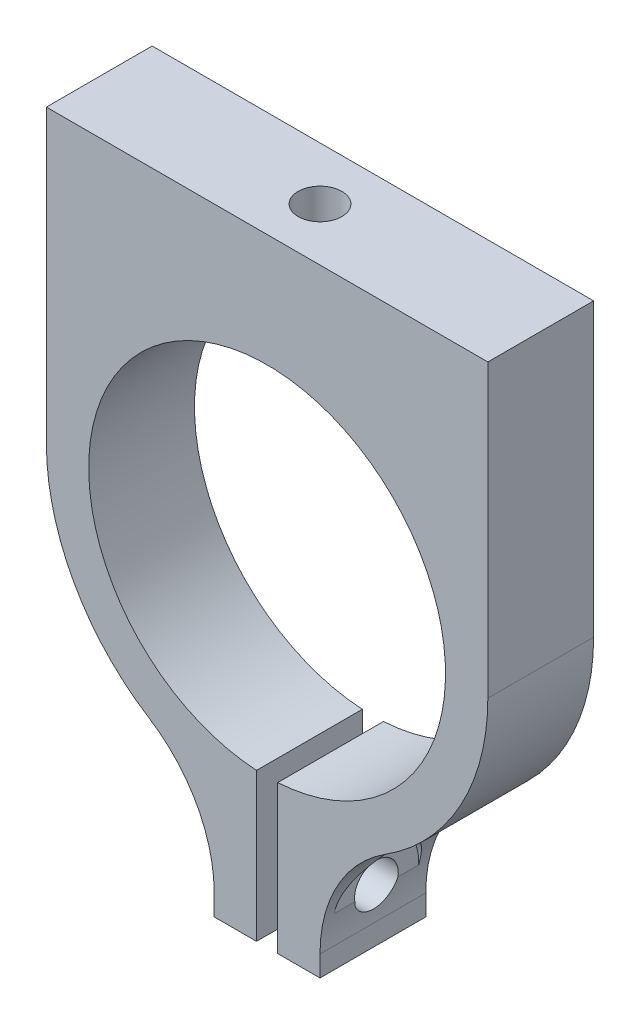
from build123d import *
from build123d.topology import SkipClean

# Parameters (mm, degrees)
BOSS_EXTRUDE1_DEPTH   = 20
SKETCH2_W             = 3
SKETCH2_H             = 10.5
BOSS_EXTRUDE2_DEPTH   = 20
SKETCH4_W             = 31.3
SKETCH4_H             = 40
BOSS_EXTRUDE3_DEPTH   = 5
SKETCH5_W             = 25
SKETCH5_H             = 37.777747226
CUT_EXTRUDE2_DEPTH    = 13.65
SKETCH6_R             = 1.55
MOTORMOUNTHOLES_DEPTH = 6
CLAMPHOLES_REACH      = 38.211
SKETCH8_R             = 1.55
ENDSTOPPER_DEPTH      = 2
CUT_EXTRUDE7_START    = -15.65
SKETCH10_W            = 25
SKETCH10_H            = 37.777747226
CUT_EXTRUDE7_DEPTH    = 13.65
SKETCH11_W            = 25
SKETCH11_H            = 10.636850541
CUT_EXTRUDE8_DEPTH    = 4
FILLET1_START         = -20
FILLET1_DEPTH         = 2.1999999
FILLET1_START_2       = -14.6999999
FILLET1_2_DEPTH       = 2.1999999
FILLET1_START_3       = 12.5
FILLET1_3_DEPTH       = 2.1999999
FILLET1_START_4       = 17.8000001
FILLET1_4_DEPTH       = 2.1999999
FILLET1_START_5       = -17.8000001
FILLET1_5_DEPTH       = 3.1000002
FILLET1_START_6       = 14.6999999
FILLET1_6_DEPTH       = 3.1000002
FILLET1_START_7       = -8.389376218
FILLET1_7_OUTLINE_R   = 1.55
FILLET1_7_DEPTH       = 16.778752436
SKETCH13_W            = 10
SKETCH13_H            = 10
CUT_EXTRUDE10_REACH   = 40.348
CUT_EXTRUDE10_START   = 4
SKETCH15_R            = 3
CUT_EXTRUDE11_START   = -4
CUT_EXTRUDE11_DEPTH   = 3
SKETCH17_R            = 6
SHAFT_CLEARANCE_DEPTH = 0.4
SKETCH18_W            = 60.470736223
SKETCH18_H            = 67.356637863
CUT_EXTRUDE12_DEPTH   = 25
SKETCH19_R            = 1.55
CUT_EXTRUDE13_DEPTH   = 7
CUT_EXTRUDE14_START   = -3
CUT_EXTRUDE14_DEPTH   = 2.6


with BuildPart() as part:
    # Sketch1 → Boss-Extrude1 (new, symmetric)
    with BuildSketch(Plane.XY):
        with BuildLine():
            Line((-15.65, 15.65), (-15.65, 0))
            ThreePointArc((-15.65, 0), (-11.066221106, 11.066221145), (5.4e-08, 15.65))
            Line((5.4e-08, 15.65), (-15.65, 15.65))
        make_face()
        with BuildLine():
            Line((15.65, 15.65), (5.4e-08, 15.65))
            ThreePointArc((5.4e-08, 15.65), (11.066221145, 11.066221106), (15.65, 0))
            Line((15.65, 0), (15.65, 15.65))
        make_face()
        with BuildLine():
            ThreePointArc((5.4e-08, 15.65), (-11.066221106, 11.066221145), (-15.65, 0))
            ThreePointArc((-15.65, 0), (-11.328283189, -10.797800702), (-0.75, -15.632018424))
            Line((-0.75, -15.632018424), (-0.75, -12.627747226))
            ThreePointArc((-0.75, -12.627747226), (-8.675684411, 9.206247878), (12.65, 0))
            ThreePointArc((12.65, 0), (9.206247878, -8.675684411), (0.75, -12.627747226))
            Line((0.75, -12.627747226), (0.75, -15.632018424))
            ThreePointArc((0.75, -15.632018424), (11.328283189, -10.797800702), (15.65, 0))
            ThreePointArc((15.65, 0), (11.066221145, 11.066221106), (5.4e-08, 15.65))
        make_face()
    extrude(amount=BOSS_EXTRUDE1_DEPTH, both=True)

    # Sketch2 → Boss-Extrude2 (add, symmetric)
    with BuildSketch(Plane.XY):
        with Locations((-2.25, -17.877747226)):
            Rectangle(SKETCH2_W, SKETCH2_H)
        with Locations((2.25, -17.877747226)):
            Rectangle(SKETCH2_W, SKETCH2_H)
    extrude(amount=BOSS_EXTRUDE2_DEPTH, both=True)

    # Sketch4 → Boss-Extrude3 (add)
    with BuildSketch(Plane(origin=(0, 15.65, 0), x_dir=(1, 0, 0), z_dir=(0, 1, 0))):
        Rectangle(SKETCH4_W, SKETCH4_H)
    extrude(amount=BOSS_EXTRUDE3_DEPTH)

    # Sketch5 → Cut-Extrude2 (cut)
    with BuildSketch(Plane(origin=(15.65, 0, 0), x_dir=(0, 0, -1), z_dir=(1, 0, 0))):
        with Locations((0, -4.238873613)):
            Rectangle(SKETCH5_W, SKETCH5_H)
    extrude(amount=-CUT_EXTRUDE2_DEPTH, mode=Mode.SUBTRACT)

    # Sketch6 → MotorMountHoles (cut)
    with BuildSketch(Plane(origin=(0, 20.65, 0), x_dir=(1, 0, 0), z_dir=(0, 1, 0))):
        with Locations(Location((-8.838834765, 8.838834765, 0), (0, 0, 270))):
            Circle(SKETCH6_R)
        with Locations(Location((8.838834765, 8.838834765, 0), (0, 0, 270))):
            Circle(SKETCH6_R)
        with Locations(Location((8.838834765, -8.838834765, 0), (0, 0, 270))):
            Circle(SKETCH6_R)
        with Locations(Location((-8.838834765, -8.838834765, 0), (0, 0, 270))):
            Circle(SKETCH6_R)
    extrude(amount=-MOTORMOUNTHOLES_DEPTH, mode=Mode.SUBTRACT)

    # ClampHoles: up to this face of the body (flat: up to its plane)
    clampholes_end = Plane(part.part.faces().sort_by_distance((3.75, -19.16091251, 16.25))[0])
    # Sketch8 → ClampHoles (cut, up to the picked face)
    with BuildSketch(Plane.ZY.offset(3.75), mode=Mode.PRIVATE) as clampholes_sk1:
        with Locations(Location((16.25, -19.194077794, 0), (0, 0, 270))):
            Circle(SKETCH8_R)
    clampholes_tool1 = split(extrude(clampholes_sk1.sketch, amount=-CLAMPHOLES_REACH, mode=Mode.PRIVATE), bisect_by=clampholes_end, keep=Keep.BOTH, mode=Mode.PRIVATE)
    # Sketch8 → ClampHoles (cut, up to the picked face)
    with BuildSketch(Plane.ZY.offset(3.75), mode=Mode.PRIVATE) as clampholes_sk2:
        with Locations(Location((-16.25, -19.194077794, 0), (0, 0, 270))):
            Circle(SKETCH8_R)
    clampholes_tool2 = split(extrude(clampholes_sk2.sketch, amount=-CLAMPHOLES_REACH, mode=Mode.PRIVATE), bisect_by=clampholes_end, keep=Keep.BOTH, mode=Mode.PRIVATE)
    add(clampholes_tool1.solids().sort_by(Axis((-3.75, -19.194078, 16.25), (1, 0, 0)))[0], mode=Mode.SUBTRACT)
    add(clampholes_tool2.solids().sort_by(Axis((-3.75, -19.194078, -16.25), (1, 0, 0)))[0], mode=Mode.SUBTRACT)

    # Sketch9 → EndStopper (add)
    with BuildSketch(Plane.XY.offset(20)):
        with BuildLine():
            ThreePointArc((12.65, 0), (-8.675684411, 9.206247878), (-0.75, -12.627747226))
            Line((-0.75, -12.627747226), (-0.75, -7.964766161))
            ThreePointArc((-0.75, -7.964766161), (-5.385164807, 5.916079783), (8, 0))
            ThreePointArc((8, 0), (5.916079783, -5.385164807), (0.75, -7.964766161))
            Line((0.75, -7.964766161), (0.75, -12.627747226))
            ThreePointArc((0.75, -12.627747226), (9.206247878, -8.675684411), (12.65, 0))
        make_face()
    extrude(amount=-ENDSTOPPER_DEPTH)

    # Sketch10 → Cut-Extrude7 (cut)
    with BuildSketch(Plane(origin=(0, 0, 0), x_dir=(0, 0, -1), z_dir=(1, 0, 0)).offset(CUT_EXTRUDE7_START)):
        with Locations((0, -4.238873613)):
            Rectangle(SKETCH10_W, SKETCH10_H)
    extrude(amount=CUT_EXTRUDE7_DEPTH, mode=Mode.SUBTRACT)

    # Sketch11 → Cut-Extrude8 (cut)
    with BuildSketch(Plane.ZY.offset(2)):
        with Locations((0, -17.809321955)):
            Rectangle(SKETCH11_W, SKETCH11_H)
    extrude(amount=-CUT_EXTRUDE8_DEPTH, mode=Mode.SUBTRACT)

    # Fillet1: read off the stored shape, not the designer's step
    # Fillet1 outline → Fillet1 (add)
    with BuildSketch(Plane.XY.offset(FILLET1_START)):
        with BuildLine():
            Line((3.75, -15.194077794), (3.75, -21.653175287))
            ThreePointArc((3.75, -21.653175287), (4.986261134, -16.83686123), (8.389376218, -13.211391549))
            ThreePointArc((8.389376218, -13.211391549), (6.150111782, -14.39092162), (3.75, -15.194077794))
        make_face()
        with BuildLine():
            ThreePointArc((-3.75, -15.194077794), (-6.150111782, -14.39092162), (-8.389376218, -13.21139155))
            ThreePointArc((-8.389376218, -13.21139155), (-4.986261134, -16.83686123), (-3.75, -21.653175287))
            Line((-3.75, -21.653175287), (-3.75, -15.194077794))
        make_face()
    extrude(amount=FILLET1_DEPTH)

    # Fillet1 2 outline → Fillet1 2 (add)
    with BuildSketch(Plane.XY.offset(FILLET1_START_2)):
        with BuildLine():
            Line((3.75, -15.194077794), (3.75, -21.653175287))
            ThreePointArc((3.75, -21.653175287), (4.986261134, -16.83686123), (8.389376218, -13.211391549))
            ThreePointArc((8.389376218, -13.211391549), (6.150111782, -14.39092162), (3.75, -15.194077794))
        make_face()
        with BuildLine():
            ThreePointArc((-3.75, -15.194077794), (-6.150111782, -14.39092162), (-8.389376218, -13.21139155))
            ThreePointArc((-8.389376218, -13.21139155), (-4.986261134, -16.83686123), (-3.75, -21.653175287))
            Line((-3.75, -21.653175287), (-3.75, -15.194077794))
        make_face()
    extrude(amount=FILLET1_2_DEPTH)

    # Fillet1 3 outline → Fillet1 3 (add)
    with BuildSketch(Plane.XY.offset(FILLET1_START_3)):
        with BuildLine():
            Line((3.75, -15.194077794), (3.75, -21.653175287))
            ThreePointArc((3.75, -21.653175287), (4.986261134, -16.83686123), (8.389376218, -13.211391549))
            ThreePointArc((8.389376218, -13.211391549), (6.150111782, -14.39092162), (3.75, -15.194077794))
        make_face()
        with BuildLine():
            ThreePointArc((-3.75, -15.194077794), (-6.150111782, -14.39092162), (-8.389376218, -13.21139155))
            ThreePointArc((-8.389376218, -13.21139155), (-4.986261134, -16.83686123), (-3.75, -21.653175287))
            Line((-3.75, -21.653175287), (-3.75, -15.194077794))
        make_face()
    extrude(amount=FILLET1_3_DEPTH)

    # Fillet1 4 outline → Fillet1 4 (add)
    with BuildSketch(Plane.XY.offset(FILLET1_START_4)):
        with BuildLine():
            Line((3.75, -15.194077794), (3.75, -21.653175287))
            ThreePointArc((3.75, -21.653175287), (4.986261134, -16.83686123), (8.389376218, -13.211391549))
            ThreePointArc((8.389376218, -13.211391549), (6.150111782, -14.39092162), (3.75, -15.194077794))
        make_face()
        with BuildLine():
            ThreePointArc((-3.75, -15.194077794), (-6.150111782, -14.39092162), (-8.389376218, -13.21139155))
            ThreePointArc((-8.389376218, -13.21139155), (-4.986261134, -16.83686123), (-3.75, -21.653175287))
            Line((-3.75, -21.653175287), (-3.75, -15.194077794))
        make_face()
    extrude(amount=FILLET1_4_DEPTH)

    # Fillet1 5 outline → Fillet1 5 (add)
    with BuildSketch(Plane.XY.offset(FILLET1_START_5)):
        with BuildLine():
            Line((3.75, -15.194077794), (3.75, -21.653175287))
            ThreePointArc((3.75, -21.653175287), (4.986261134, -16.83686123), (8.389376218, -13.211391549))
            ThreePointArc((8.389376218, -13.211391549), (6.150111782, -14.39092162), (3.75, -15.194077794))
        make_face()
        with BuildLine():
            ThreePointArc((-3.75, -15.194077794), (-6.150111782, -14.39092162), (-8.389376218, -13.21139155))
            ThreePointArc((-8.389376218, -13.21139155), (-4.986261134, -16.83686123), (-3.75, -21.653175287))
            Line((-3.75, -21.653175287), (-3.75, -15.194077794))
        make_face()
    extrude(amount=FILLET1_5_DEPTH)

    # Fillet1 6 outline → Fillet1 6 (add)
    with BuildSketch(Plane.XY.offset(FILLET1_START_6)):
        with BuildLine():
            Line((3.75, -15.194077794), (3.75, -21.653175287))
            ThreePointArc((3.75, -21.653175287), (4.986261134, -16.83686123), (8.389376218, -13.211391549))
            ThreePointArc((8.389376218, -13.211391549), (6.150111782, -14.39092162), (3.75, -15.194077794))
        make_face()
        with BuildLine():
            ThreePointArc((-3.75, -15.194077794), (-6.150111782, -14.39092162), (-8.389376218, -13.21139155))
            ThreePointArc((-8.389376218, -13.21139155), (-4.986261134, -16.83686123), (-3.75, -21.653175287))
            Line((-3.75, -21.653175287), (-3.75, -15.194077794))
        make_face()
    extrude(amount=FILLET1_6_DEPTH)

    # Fillet1 7 outline → Fillet1 7 (cut)
    with BuildSketch(Plane.YZ.offset(FILLET1_START_7)):
        with Locations((-19.194077794, -16.25)):
            Circle(FILLET1_7_OUTLINE_R)
        with Locations((-19.194077794, 16.25)):
            Circle(FILLET1_7_OUTLINE_R)
    extrude(amount=FILLET1_7_DEPTH, mode=Mode.SUBTRACT)

    # Cut-Sweep1: sweep along a path in Sketch12
    with BuildLine(Plane(origin=(0, 0, 0), x_dir=(0, 0, -1), z_dir=(1, 0, 0))) as cut_sweep1_path:
        Line((-2.775739564, 34.353299637), (-30.459033802, 12.328988213))
    # Sketch13 → Cut-Sweep1 (sweep, cut)
    with BuildSketch(Plane(origin=(0, 11.963370534, -15.037269505), x_dir=(-1, 0, 0), z_dir=(0, 0.6225843191548198, -0.7825527238100508))):
        with Locations((0, 29.484397462)):
            Rectangle(SKETCH13_W, SKETCH13_H)
    sweep(path=cut_sweep1_path.line, mode=Mode.SUBTRACT)

    # Sketch15 → Cut-Extrude10 (cut, up to next)
    with BuildSketch(Plane(origin=(0, 0, 0), x_dir=(0, 0, -1), z_dir=(1, 0, 0)).offset(CUT_EXTRUDE10_START), mode=Mode.PRIVATE) as cut_extrude10_sk1:
        with Locations((16.25, -19.194077794)):
            Circle(SKETCH15_R)
    cut_extrude10_tool1 = extrude(cut_extrude10_sk1.sketch, amount=CUT_EXTRUDE10_REACH, mode=Mode.PRIVATE) & part.part
    cut_extrude10 = cut_extrude10_tool1.solids().sort_by_distance((4, -19.194078, -16.25))[0]
    add(cut_extrude10, mode=Mode.SUBTRACT)

    # Sketch16 → Cut-Extrude11 (cut)
    with BuildSketch(Plane(origin=(0, 0, 0), x_dir=(0, 0, -1), z_dir=(1, 0, 0)).offset(CUT_EXTRUDE11_START)):
        Polygon((12.959103466, -19.194077794), (14.604551733, -22.044077794), (17.895448267, -22.044077794), (19.540896534, -19.194077794), (17.895448267, -16.344077794), (14.604551733, -16.344077794), align=None)
    cut_extrude11 = extrude(amount=-CUT_EXTRUDE11_DEPTH, mode=Mode.SUBTRACT)

    # Mirror1: Cut-Extrude10, Cut-Extrude11 across plane
    add(cut_extrude10.mirror(Plane.XY), mode=Mode.SUBTRACT)
    add(cut_extrude11.mirror(Plane.XY), mode=Mode.SUBTRACT)

    # Sketch17 → Shaft Clearance (cut)
    with BuildSketch(Plane(origin=(0, 20.65, 0), x_dir=(1, 0, 0), z_dir=(0, 1, 0))):
        with Locations(Location((0, 0, 0), (0, 0, 270))):
            Circle(SKETCH17_R)
    extrude(amount=-SHAFT_CLEARANCE_DEPTH, mode=Mode.SUBTRACT)

    # Sketch18 → Cut-Extrude12 (cut, symmetric)
    with SkipClean():  # the faces are left unmerged after this step: merging them gives an invalid solid
        with BuildSketch(Plane(origin=(0, 0, 0), x_dir=(0, 0, -1), z_dir=(1, 0, 0))):
            with Locations((-17.735368112, 5.054402567)):
                Rectangle(SKETCH18_W, SKETCH18_H)
        extrude(amount=CUT_EXTRUDE12_DEPTH, both=True, mode=Mode.SUBTRACT)

    # Sketch19 → Cut-Extrude13 (cut)
    with SkipClean():  # the faces are left unmerged after this step: merging them gives an invalid solid
        with BuildSketch(Plane(origin=(0, 20.65, 0), x_dir=(1, 0, 0), z_dir=(0, 1, 0))):
            with Locations(Location((0, 16.25, 0), (0, 0, 270))):
                Circle(SKETCH19_R)
        extrude(amount=-CUT_EXTRUDE13_DEPTH, mode=Mode.SUBTRACT)

    # Sketch20 → Cut-Extrude14 (cut)
    with SkipClean():  # the faces are left unmerged after this step: merging them gives an invalid solid
        with BuildSketch(Plane(origin=(0, 20.65, 0), x_dir=(1, 0, 0), z_dir=(0, 1, 0)).offset(CUT_EXTRUDE14_START)):
            Polygon((-3.290896534, 16.25), (-1.645448267, 13.4), (1.645448267, 13.4), (3.290896534, 16.25), (3.290896534, 19.1), (-3.290896534, 19.1), align=None)
        extrude(amount=-CUT_EXTRUDE14_DEPTH, mode=Mode.SUBTRACT)


solid = part.part
